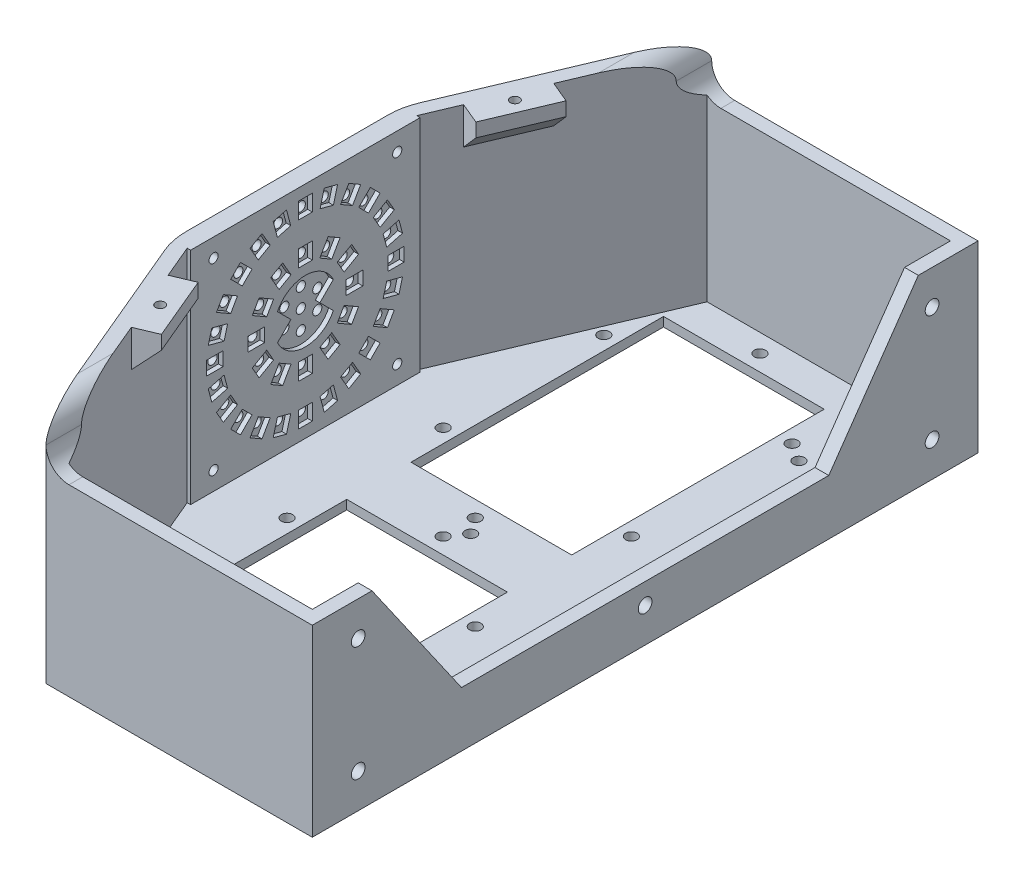
from build123d import *

# Parameters (mm, degrees)
EXTRUDE_1_DEPTH      = 4
SKETCH_2_W           = 6
SKETCH_2_H           = 290
EXTRUDE_2_DEPTH      = 80
EXTRUDE_1_2_DEPTH    = 96
SKETCH_29_W          = 8
SKETCH_29_H          = 100
EXTRUDE_5_DEPTH      = 96
SKETCH_20_W          = 6
SKETCH_20_H          = 7.125217771
SKETCH_20_W_2        = 7.125217771
SKETCH_20_H_2        = 6
SKETCH_20_H_3        = 7.251760651
SKETCH_20_W_3        = 7.251760651
CUT_EXTRUDE_7_DEPTH  = 2
SKETCH_16_R          = 3
CUT_EXTRUDE_6_DEPTH  = 20
SKETCH_21_R          = 2
LED_DEPTH            = 10
SKETCH_22_W          = 116
SKETCH_22_H          = 290
CUT_EXTRUDE_9_DEPTH  = 20
FILLET_2_R           = 10
FILLET_3_R           = 30
SKETCH_23_W          = 30
SKETCH_23_H          = 6
EXTRUDE_3_DEPTH      = 10
SKETCH_24_W          = 30
SKETCH_24_H          = 6
EXTRUDE_4_DEPTH      = 10
CHAMFER_1_SIZE       = 10
CUT_EXTRUDE_10_DEPTH = 10
CHAMFER_2_SIZE       = 2
SKETCH_30_R          = 2
CUT_EXTRUDE_11_DEPTH = 7
SKETCH_32_R          = 2
CUT_EXTRUDE_13_DEPTH = 7
CHAMFER_3_SIZE       = 2
SKETCH_33_W          = 70
SKETCH_33_H          = 110
CUT_EXTRUDE_14_DEPTH = 10
SKETCH_34_R          = 2.5
CUT_EXTRUDE_15_DEPTH = 10
CHAMFER_4_SIZE       = 2


# Some blends are built 0.0001 mm under size
with BuildPart() as part:
    # Эскиз1 → Extrude 1 (new body)
    with BuildSketch(Plane(origin=(0, 0, 0), x_dir=(1, 0, 0), z_dir=(0, 1, 0))):
        Polygon((-95, -50), (-95, 50), (-55, 145), (55, 145), (55, -145), (-55, -145), align=None)
    extrude(amount=EXTRUDE_1_DEPTH)

    # Эскиз2 → Бобышка-Вытянуть2 (add)
    with BuildSketch(Plane(origin=(0, 0, 0), x_dir=(1, 0, 0), z_dir=(0, 1, 0))):
        with Locations((58, 0)):
            Rectangle(SKETCH_2_W, SKETCH_2_H)
    extrude(amount=EXTRUDE_2_DEPTH)

    # Эскиз17 → Extrude 1 2 (add)
    with BuildSketch(Plane(origin=(0, 4, 0), x_dir=(1, 0, 0), z_dir=(0, 1, 0))):
        Polygon((-55, 145), (-95, 50), (-95, -50), (-55, -145), (61, -145), (61, 145), align=None)
        Polygon((-51.016149012, 139), (-89, 48.788353904), (-89, -48.788353904), (-51.016149012, -139), (55, -139), (55, 139), align=None, mode=Mode.SUBTRACT)
    extrude(amount=EXTRUDE_1_2_DEPTH)

    # Эскиз29 → Бобышка-Вытянуть5 (add)
    with BuildSketch(Plane(origin=(0, 100, 0), x_dir=(1, 0, 0), z_dir=(0, 1, 0))):
        with Locations((-91, 0)):
            Rectangle(SKETCH_29_W, SKETCH_29_H)
    extrude(amount=-EXTRUDE_5_DEPTH)

    # Эскиз20 → Вырез-Вытянуть7 (cut)
    with BuildSketch(Plane(origin=(-87, 0, 0), x_dir=(0, 0, -1), z_dir=(1, 0, 0))):
        Polygon((8.231441461, 94.311267666), (6.387299401, 87.428835803), (12.182854359, 85.875921532), (14.026996418, 92.758353395), align=None)
        with BuildLine():
            Line((6.3, 52), (12.161242978, 57.861242978))
            ThreePointArc((12.161242978, 57.861242978), (0, 65.5), (-12.161242978, 57.861242978))
            Line((-12.161242978, 57.861242978), (-6.3, 52))
            Line((-6.3, 52), (-12.161242978, 46.138757022))
            ThreePointArc((-12.161242978, 46.138757022), (0, 38.5), (12.161242978, 46.138757022))
            Line((12.161242978, 46.138757022), (6.3, 52))
        make_face()
        with Locations((0, 91.437391115)):
            Rectangle(SKETCH_20_W, SKETCH_20_H)
        Polygon((18.901923789, 90.739092363), (15.339314903, 84.568472766), (20.535467326, 81.568472766), (24.098076211, 87.739092363), align=None)
        Polygon((28.284271247, 84.526911935), (23.245981444, 79.488622131), (27.488622131, 75.245981444), (32.526911935, 80.284271247), align=None)
        Polygon((35.739092363, 76.098076211), (29.568472766, 72.535467326), (32.568472766, 67.339314903), (38.739092363, 70.901923789), align=None)
        Polygon((40.758353395, 66.026996418), (33.875921532, 64.182854359), (35.428835803, 58.387299401), (42.311267666, 60.231441461), align=None)
        with Locations((39.437391115, 52)):
            Rectangle(SKETCH_20_W_2, SKETCH_20_H_2)
        Polygon((42.311267666, 43.768558539), (35.428835803, 45.612700599), (33.875921532, 39.817145641), (40.758353395, 37.973003582), align=None)
        Polygon((38.739092363, 33.098076211), (32.568472766, 36.660685097), (29.568472766, 31.464532674), (35.739092363, 27.901923789), align=None)
        Polygon((32.526911935, 23.715728753), (27.488622131, 28.754018556), (23.245981444, 24.511377869), (28.284271247, 19.473088065), align=None)
        Polygon((24.098076211, 16.260907637), (20.535467326, 22.431527234), (15.339314903, 19.431527234), (18.901923789, 13.260907637), align=None)
        Polygon((14.026996418, 11.241646605), (12.182854359, 18.124078468), (6.387299401, 16.571164197), (8.231441461, 9.688732334), align=None)
        with Locations((0, 12.562608886)):
            Rectangle(SKETCH_20_W, SKETCH_20_H)
        Polygon((-8.231441461, 9.688732334), (-6.387299401, 16.571164197), (-12.182854359, 18.124078468), (-14.026996418, 11.241646605), align=None)
        Polygon((-18.901923789, 13.260907637), (-15.339314903, 19.431527234), (-20.535467326, 22.431527234), (-24.098076211, 16.260907637), align=None)
        Polygon((-28.284271247, 19.473088065), (-23.245981444, 24.511377869), (-27.488622131, 28.754018556), (-32.526911935, 23.715728753), align=None)
        Polygon((-35.739092363, 27.901923789), (-29.568472766, 31.464532674), (-32.568472766, 36.660685097), (-38.739092363, 33.098076211), align=None)
        Polygon((-40.758353395, 37.973003582), (-33.875921532, 39.817145641), (-35.428835803, 45.612700599), (-42.311267666, 43.768558539), align=None)
        with Locations((-39.437391115, 52)):
            Rectangle(SKETCH_20_W_2, SKETCH_20_H_2)
        Polygon((-42.311267666, 60.231441461), (-35.428835803, 58.387299401), (-33.875921532, 64.182854359), (-40.758353395, 66.026996418), align=None)
        Polygon((-38.739092363, 70.901923789), (-32.568472766, 67.339314903), (-29.568472766, 72.535467326), (-35.739092363, 76.098076211), align=None)
        Polygon((-32.526911935, 80.284271247), (-27.488622131, 75.245981444), (-23.245981444, 79.488622131), (-28.284271247, 84.526911935), align=None)
        Polygon((-24.098076211, 87.739092363), (-20.535467326, 81.568472766), (-15.339314903, 84.568472766), (-18.901923789, 90.739092363), align=None)
        Polygon((-14.026996418, 92.758353395), (-12.182854359, 85.875921532), (-6.387299401, 87.428835803), (-8.231441461, 94.311267666), align=None)
        Polygon((6.276043463, 68.870426149), (9.901923789, 75.150635095), (15.098076211, 72.150635095), (11.472195886, 65.870426149), align=None)
        with Locations((0, 73.374119675)):
            Rectangle(SKETCH_20_W, SKETCH_20_H_3)
        Polygon((13.870426149, 63.472195886), (20.150635095, 67.098076211), (23.150635095, 61.901923789), (16.870426149, 58.276043463), align=None)
        with Locations((21.374119675, 52)):
            Rectangle(SKETCH_20_W_3, SKETCH_20_H_2)
        Polygon((16.870426149, 45.723956537), (23.150635095, 42.098076211), (20.150635095, 36.901923789), (13.870426149, 40.527804114), align=None)
        Polygon((11.472195886, 38.129573851), (15.098076211, 31.849364905), (9.901923789, 28.849364905), (6.276043463, 35.129573851), align=None)
        with Locations((0, 30.625880326)):
            Rectangle(SKETCH_20_W, SKETCH_20_H_3)
        Polygon((-6.276043463, 35.129573851), (-9.901923789, 28.849364905), (-15.098076211, 31.849364905), (-11.472195886, 38.129573851), align=None)
        Polygon((-13.870426149, 40.527804114), (-20.150635095, 36.901923789), (-23.150635095, 42.098076211), (-16.870426149, 45.723956537), align=None)
        with Locations((-21.374119675, 52)):
            Rectangle(SKETCH_20_W_3, SKETCH_20_H_2)
        Polygon((-16.870426149, 58.276043463), (-23.150635095, 61.901923789), (-20.150635095, 67.098076211), (-13.870426149, 63.472195886), align=None)
        Polygon((-11.472195886, 65.870426149), (-15.098076211, 72.150635095), (-9.901923789, 75.150635095), (-6.276043463, 68.870426149), align=None)
    extrude(amount=-CUT_EXTRUDE_7_DEPTH, mode=Mode.SUBTRACT)

    # Эскиз16 → Вырез-Вытянуть6 (cut)
    with BuildSketch(Plane(origin=(61, 0, 0), x_dir=(0, 0, -1), z_dir=(1, 0, 0))):
        with Locations((0, 65)):
            Circle(SKETCH_16_R)
        with Locations((0, 15)):
            Circle(SKETCH_16_R)
        with Locations((125, 65)):
            Circle(SKETCH_16_R)
        with Locations((-125, 65)):
            Circle(SKETCH_16_R)
        with Locations((-125, 15)):
            Circle(SKETCH_16_R)
        with Locations((125, 15)):
            Circle(SKETCH_16_R)
    extrude(amount=-CUT_EXTRUDE_6_DEPTH, mode=Mode.SUBTRACT)

    # Эскиз21 → Отверстия под LED (cut)
    with BuildSketch(Plane(origin=(-87, 0, 0), x_dir=(0, 0, -1), z_dir=(1, 0, 0))):
        with Locations((0, 90.5)):
            Circle(SKETCH_21_R)
        with Locations((9.964533236, 89.188144312)):
            Circle(SKETCH_21_R)
        with Locations((19.25, 85.341978046)):
            Circle(SKETCH_21_R)
        with Locations((27.223611076, 79.223611076)):
            Circle(SKETCH_21_R)
        with Locations((33.341978046, 71.25)):
            Circle(SKETCH_21_R)
        with Locations((37.188144312, 61.964533236)):
            Circle(SKETCH_21_R)
        with Locations((38.5, 52)):
            Circle(SKETCH_21_R)
        with Locations((37.188144312, 42.035466764)):
            Circle(SKETCH_21_R)
        with Locations((33.341978046, 32.75)):
            Circle(SKETCH_21_R)
        with Locations((27.223611076, 24.776388924)):
            Circle(SKETCH_21_R)
        with Locations((19.25, 18.658021954)):
            Circle(SKETCH_21_R)
        with Locations((9.964533236, 14.811855688)):
            Circle(SKETCH_21_R)
        with Locations((0, 13.5)):
            Circle(SKETCH_21_R)
        with Locations((-9.964533236, 14.811855688)):
            Circle(SKETCH_21_R)
        with Locations((-19.25, 18.658021954)):
            Circle(SKETCH_21_R)
        with Locations((-27.223611076, 24.776388924)):
            Circle(SKETCH_21_R)
        with Locations((-33.341978046, 32.75)):
            Circle(SKETCH_21_R)
        with Locations((-37.188144312, 42.035466764)):
            Circle(SKETCH_21_R)
        with Locations((-38.5, 52)):
            Circle(SKETCH_21_R)
        with Locations((-37.188144312, 61.964533236)):
            Circle(SKETCH_21_R)
        with Locations((-33.341978046, 71.25)):
            Circle(SKETCH_21_R)
        with Locations((-27.223611076, 79.223611076)):
            Circle(SKETCH_21_R)
        with Locations((-19.25, 85.341978046)):
            Circle(SKETCH_21_R)
        with Locations((-9.964533236, 89.188144312)):
            Circle(SKETCH_21_R)
        with Locations((0, 73)):
            Circle(SKETCH_21_R)
        with Locations((10.5, 70.186533479)):
            Circle(SKETCH_21_R)
        with Locations((18.186533479, 62.5)):
            Circle(SKETCH_21_R)
        with Locations((21, 52)):
            Circle(SKETCH_21_R)
        with Locations((18.186533479, 41.5)):
            Circle(SKETCH_21_R)
        with Locations((10.5, 33.813466521)):
            Circle(SKETCH_21_R)
        with Locations((0, 31)):
            Circle(SKETCH_21_R)
        with Locations((-10.5, 33.813466521)):
            Circle(SKETCH_21_R)
        with Locations((-18.186533479, 41.5)):
            Circle(SKETCH_21_R)
        with Locations((-21, 52)):
            Circle(SKETCH_21_R)
        with Locations((-18.186533479, 62.5)):
            Circle(SKETCH_21_R)
        with Locations((-10.5, 70.186533479)):
            Circle(SKETCH_21_R)
        with Locations((0, 60.3)):
            Circle(SKETCH_21_R)
        with Locations((7.188010851, 56.15)):
            Circle(SKETCH_21_R)
        with Locations((7.188010851, 47.85)):
            Circle(SKETCH_21_R)
        with Locations((0, 43.7)):
            Circle(SKETCH_21_R)
        with Locations((-7.188010851, 47.85)):
            Circle(SKETCH_21_R)
        with Locations((-7.188010851, 56.15)):
            Circle(SKETCH_21_R)
        with Locations((0, 52)):
            Circle(SKETCH_21_R)
    extrude(amount=-LED_DEPTH, mode=Mode.SUBTRACT)

    # Эскиз22 → Вырез-Вытянуть9 (cut)
    with BuildSketch(Plane(origin=(0, 100, 0), x_dir=(1, 0, 0), z_dir=(0, 1, 0))):
        with Locations((3, 0)):
            Rectangle(SKETCH_22_W, SKETCH_22_H)
    extrude(amount=-CUT_EXTRUDE_9_DEPTH, mode=Mode.SUBTRACT)

    # Скругление2
    # the kernel refuses this fillet: 10 mm, written as the material it adds along each edge
    with BuildSketch(Plane(origin=(-55, 80, -145), x_dir=(0, 1, 0), z_dir=(0, 0, 1))) as fillet_2_piece_1_section:
        with BuildLine():
            CenterArc((FILLET_2_R, -FILLET_2_R), FILLET_2_R, 90, 90)
            Line((0, -FILLET_2_R), (0, 0))
            Line((0, 0), (FILLET_2_R, 0))
        make_face()
    fillet_2_piece_1 = extrude(amount=40.461646096, mode=Mode.PRIVATE)
    fillet_2_piece_1 = split(fillet_2_piece_1, bisect_by=Plane(origin=(-53.171006358, 82.420075, -139), z_dir=(0, 0, -1)), keep=Keep.TOP, mode=Mode.PRIVATE)
    add(fillet_2_piece_1)
    with BuildSketch(Plane(origin=(-55, 80, -170), x_dir=(0, 1, 0), z_dir=(0, 0, 1))) as fillet_2_piece_2_section:
        with BuildLine():
            CenterArc((FILLET_2_R, -FILLET_2_R), FILLET_2_R, 90, 90)
            Line((0, -FILLET_2_R), (0, 0))
            Line((0, 0), (FILLET_2_R, 0))
        make_face()
    fillet_2_piece_2 = extrude(amount=65.461646096, mode=Mode.PRIVATE)
    fillet_2_piece_2 = split(fillet_2_piece_2, bisect_by=Plane(origin=(-52.715017751, 83.017793979, -134.965186746), z_dir=(-0.9216353751380651, 0, -0.3880570000581331)), keep=Keep.TOP, mode=Mode.PRIVATE)
    fillet_2_piece_2 = split(fillet_2_piece_2, bisect_by=Plane(origin=(-53.969192832, 83.017793979, -139), z_dir=(0, 0, 1)), keep=Keep.TOP, mode=Mode.PRIVATE)
    add(fillet_2_piece_2)
    with BuildSketch(Plane(origin=(-55, 80, 104.538353904), x_dir=(0, 1, 0), z_dir=(0, 0, 1))) as fillet_2_piece_3_section:
        with BuildLine():
            CenterArc((FILLET_2_R, -FILLET_2_R), FILLET_2_R, 90, 90)
            Line((0, -FILLET_2_R), (0, 0))
            Line((0, 0), (FILLET_2_R, 0))
        make_face()
    fillet_2_piece_3 = extrude(amount=40.461646096, mode=Mode.PRIVATE)
    fillet_2_piece_3 = split(fillet_2_piece_3, bisect_by=Plane(origin=(-48.828623245, 80.420001638, 139), z_dir=(0, 0, 1)), keep=Keep.TOP, mode=Mode.PRIVATE)
    add(fillet_2_piece_3)
    with BuildSketch(Plane(origin=(-55, 80, 104.538353904), x_dir=(0, 1, 0), z_dir=(0, 0, 1))) as fillet_2_piece_4_section:
        with BuildLine():
            CenterArc((FILLET_2_R, -FILLET_2_R), FILLET_2_R, 90, 90)
            Line((0, -FILLET_2_R), (0, 0))
            Line((0, 0), (FILLET_2_R, 0))
        make_face()
    fillet_2_piece_4 = extrude(amount=65.461646096, mode=Mode.PRIVATE)
    fillet_2_piece_4 = split(fillet_2_piece_4, bisect_by=Plane(origin=(-52.715017751, 83.017793979, 134.965186746), z_dir=(-0.9216353751380651, 0, 0.38805700005813304)), keep=Keep.TOP, mode=Mode.PRIVATE)
    fillet_2_piece_4 = split(fillet_2_piece_4, bisect_by=Plane(origin=(-53.969192832, 83.017793979, 139), z_dir=(0, 0, -1)), keep=Keep.TOP, mode=Mode.PRIVATE)
    add(fillet_2_piece_4)
    # the kernel refuses this fillet: 10 mm, written as the material it takes off along each edge
    with BuildSketch(Plane(origin=(-55, 100, -170), x_dir=(0, -1, 0), z_dir=(0, 0, 1)), Plane(origin=(-55, 100, 104.538353904), x_dir=(0, -1, 0), z_dir=(0, 0, 1))) as fillet_2_2_piece_1:
        with BuildLine():
            CenterArc((FILLET_2_R, -FILLET_2_R), FILLET_2_R, 90, 90)
            Line((0, -FILLET_2_R), (0, 0))
            Line((0, 0), (FILLET_2_R, 0))
        make_face()
    extrude(amount=65.461646096, mode=Mode.SUBTRACT)

    # Скругление3
    fillet_3_edges = [part.edges().sort_by_distance(p)[0] for p in [
        (-95, 50, 50),
        (-95, 50, -50),
    ]]
    fillet(fillet_3_edges, radius=FILLET_3_R)

    # Эскиз23 → Бобышка-Вытянуть3 (add)
    with BuildSketch(Plane(origin=(-93.046658337, 0, -39.177540353), x_dir=(0.38805700005813276, 0, -0.9216353751380653), z_dir=(0.9216353751380653, 0, 0.38805700005813276))):
        with Locations((42.320809752, 97)):
            Rectangle(SKETCH_23_W, SKETCH_23_H)
    extrude(amount=EXTRUDE_3_DEPTH)

    # Эскиз24 → Бобышка-Вытянуть4 (add)
    with BuildSketch(Plane(origin=(-93.046658337, 0, 39.177540353), x_dir=(-0.3880570000581327, 0, -0.9216353751380654), z_dir=(0.9216353751380654, 0, -0.3880570000581327))):
        with Locations((-42.320809752, 97)):
            Rectangle(SKETCH_24_W, SKETCH_24_H)
    extrude(amount=EXTRUDE_4_DEPTH)

    # Фаска1
    chamfer_1_edges = [part.edges().sort_by_distance(p)[0] for p in [
        (-76.623771865, 94, -78.181895724),
        (-76.623771865, 94, 78.181895724),
    ]]
    chamfer(chamfer_1_edges, length=CHAMFER_1_SIZE - 0.0001)  # a hair under: the kernel refuses the full size

    # Эскиз27 → Вырез-Вытянуть10 (cut)
    with BuildSketch(Plane(origin=(61, 0, 0), x_dir=(0, 0, -1), z_dir=(1, 0, 0))):
        Polygon((-80, 24), (80, 24), (119, 80), (-119, 80), align=None)
    extrude(amount=-CUT_EXTRUDE_10_DEPTH, mode=Mode.SUBTRACT)

    # Фаска2
    chamfer_2_edges = [part.edges().sort_by_distance(p)[0] for p in [
        (-95, 32.75, 35.341978046),
        (-95, 42.035466764, 39.188144312),
        (-95, 52, 40.5),
        (-95, 61.964533236, 39.188144312),
        (-95, 71.25, 35.341978046),
        (-95, 79.223611076, 29.223611076),
        (-95, 85.341978046, 21.25),
        (-95, 89.188144312, 11.964533236),
        (-95, 24.776388924, 29.223611076),
        (-95, 18.658021954, 21.25),
        (-95, 14.811855688, 11.964533236),
        (-95, 13.5, 2),
        (-95, 14.811855688, -7.964533236),
        (-95, 18.658021954, -17.25),
        (-95, 24.776388924, -25.223611076),
        (-95, 32.75, -31.341978046),
        (-95, 42.035466764, -35.188144312),
        (-95, 52, -36.5),
        (-95, 61.964533236, -35.188144312),
        (-95, 71.25, -31.341978046),
        (-95, 79.223611076, -25.223611076),
        (-95, 85.341978046, -17.25),
        (-95, 89.188144312, -7.964533236),
        (-95, 90.5, 2),
    ]]
    chamfer(chamfer_2_edges, length=CHAMFER_2_SIZE)

    # Эскиз30 → Вырез-Вытянуть11 (cut)
    with BuildSketch(Plane(origin=(-87, 0, 0), x_dir=(0, 0, -1), z_dir=(1, 0, 0))):
        with Locations((-40, 92)):
            Circle(SKETCH_30_R)
        with Locations((40, 92)):
            Circle(SKETCH_30_R)
        with Locations((-40, 12)):
            Circle(SKETCH_30_R)
        with Locations((40, 12)):
            Circle(SKETCH_30_R)
    extrude(amount=-CUT_EXTRUDE_11_DEPTH, mode=Mode.SUBTRACT)

    # Эскиз32 → Вырез-Вытянуть13 (cut)
    with BuildSketch(Plane(origin=(0, 100, 0), x_dir=(1, 0, 0), z_dir=(0, 1, 0))):
        with Locations(Location((-73, 77.261926747, 0), (0, 0, 270))):
            Circle(SKETCH_32_R)
        with Locations(Location((-73, -77.261926747, 0), (0, 0, 90))):
            Circle(SKETCH_32_R)
    extrude(amount=-CUT_EXTRUDE_13_DEPTH, mode=Mode.SUBTRACT)

    # Фаска3
    chamfer_3_edges = [part.edges().sort_by_distance(p)[0] for p in [
        (-95, 60.3, 2),
        (-95, 56.15, 9.188010851),
        (-95, 47.85, 9.188010851),
        (-95, 43.7, 2),
        (-95, 47.85, -5.188010851),
        (-95, 56.15, -5.188010851),
        (-95, 52, 2),
    ]]
    chamfer(chamfer_3_edges, length=CHAMFER_3_SIZE)

    # Эскиз33 → Вырез-Вытянуть14 (cut)
    with BuildSketch(Plane(origin=(0, 4, 0), x_dir=(1, 0, 0), z_dir=(0, 1, 0))):
        with Locations((-20, 69)):
            Rectangle(SKETCH_33_W, SKETCH_33_H)
        with Locations((-20, -69)):
            Rectangle(SKETCH_33_W, SKETCH_33_H)
    extrude(amount=-CUT_EXTRUDE_14_DEPTH, mode=Mode.SUBTRACT)

    # Эскиз34 → Вырез-Вытянуть15 (cut)
    with BuildSketch(Plane(origin=(0, 4, 0), x_dir=(1, 0, 0), z_dir=(0, 1, 0))):
        with Locations(Location((-20, 131, 0), (0, 0, 270))):
            Circle(SKETCH_34_R)
        with Locations(Location((21, 104, 0), (0, 0, 270))):
            Circle(SKETCH_34_R)
        with Locations(Location((-61, 104, 0), (0, 0, 90))):
            Circle(SKETCH_34_R)
        with Locations(Location((-61, 34, 0), (0, 0, 270))):
            Circle(SKETCH_34_R)
        with Locations(Location((21, 34, 0), (0, 0, 90))):
            Circle(SKETCH_34_R)
        with Locations(Location((21, -34, 0), (0, 0, 270))):
            Circle(SKETCH_34_R)
        with Locations(Location((-61, -34, 0), (0, 0, 90))):
            Circle(SKETCH_34_R)
        with Locations(Location((-61, -104, 0), (0, 0, 270))):
            Circle(SKETCH_34_R)
        with Locations(Location((21, -104, 0), (0, 0, 90))):
            Circle(SKETCH_34_R)
        with Locations(Location((-20, -131, 0), (0, 0, 90))):
            Circle(SKETCH_34_R)
        with Locations(Location((-20, 7, 0), (0, 0, 90))):
            Circle(SKETCH_34_R)
        with Locations(Location((-20, -7, 0), (0, 0, 270))):
            Circle(SKETCH_34_R)
        with Locations(Location((29, 99, 0), (0, 0, 270))):
            Circle(SKETCH_34_R)
        with Locations(Location((29, -99, 0), (0, 0, 90))):
            Circle(SKETCH_34_R)
        with Locations(Location((-15, 0, 0), (0, 0, 270))):
            Circle(SKETCH_34_R)
    extrude(amount=-CUT_EXTRUDE_15_DEPTH, mode=Mode.SUBTRACT)

    # Фаска4
    chamfer_4_edges = [part.edges().sort_by_distance(p)[0] for p in [
        (-95, 70.186533479, -8.5),
        (-95, 62.5, -16.186533479),
        (-95, 52, -19),
        (-95, 41.5, -16.186533479),
        (-95, 33.813466521, -8.5),
        (-95, 31, 2),
        (-95, 33.813466521, 12.5),
        (-95, 73, 2),
        (-95, 70.186533479, 12.5),
        (-95, 62.5, 20.186533479),
        (-95, 52, 23),
        (-95, 41.5, 20.186533479),
    ]]
    chamfer(chamfer_4_edges, length=CHAMFER_4_SIZE)


solid = part.part
